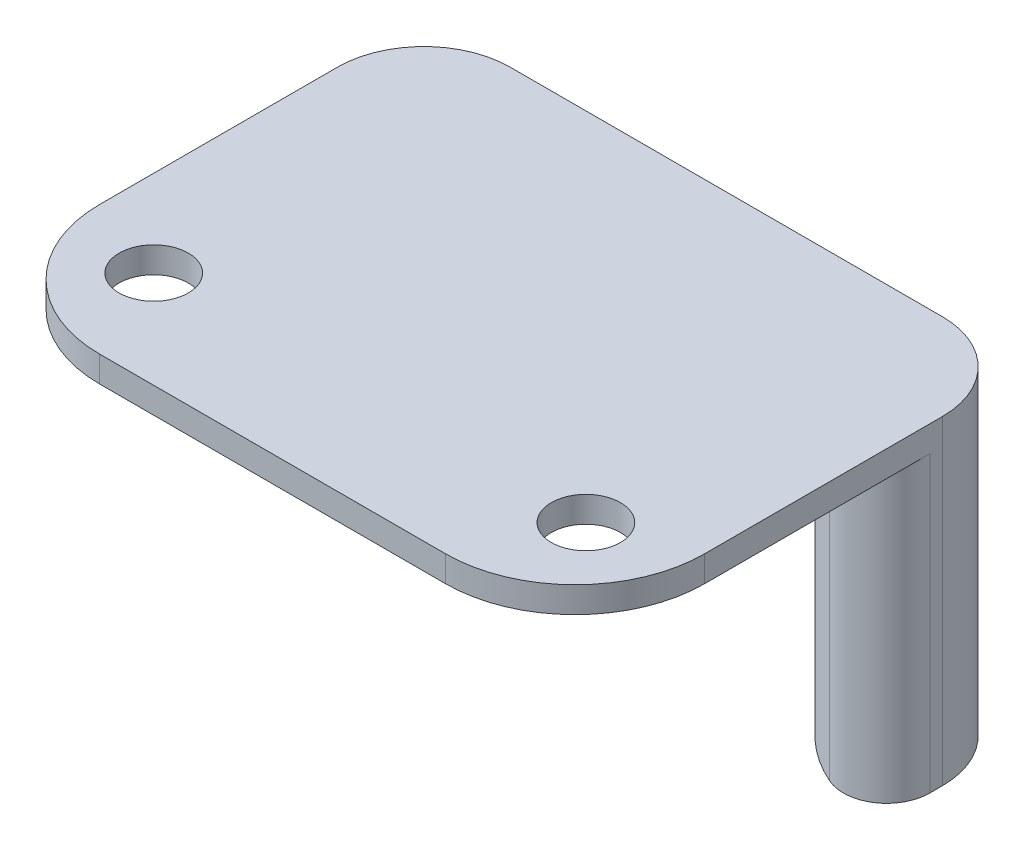
from build123d import *

# Parameters (mm, degrees)
SZKIC1_W                    = 28
SZKIC1_H                    = 21
SZKIC1_R                    = 1.6
DODANIE_WYCI_GNI_CIE1_DEPTH = 1.2
DODANIE_WYCI_GNI_CIE2_DEPTH = 13.6
ZAOKR_GLENIE3_R             = 6
ZAOKR_GLENIE1_R             = 4
ZAOKR_GLENIE2_R             = 2


with BuildPart() as part:
    # Szkic1 → Dodanie-wyciągnięcie1 (new body)
    with BuildSketch(Plane(origin=(0, 0, 0), x_dir=(1, 0, 0), z_dir=(0, 1, 0))):
        with Locations((0, 6)):
            Rectangle(SZKIC1_W, SZKIC1_H)
        with Locations((10, 0)):
            Circle(SZKIC1_R, mode=Mode.SUBTRACT)
        with Locations((-10, 0)):
            Circle(SZKIC1_R, mode=Mode.SUBTRACT)
    extrude(amount=DODANIE_WYCI_GNI_CIE1_DEPTH)

    # Szkic2 → Dodanie-wyciągnięcie2 (add)
    with BuildSketch(Plane.XZ):
        with BuildLine():
            Line((-14, -16.5), (-14, -9.5))
            ThreePointArc((-14, -9.5), (-9.050252532, -11.550252532), (-7, -16.5))
            Line((-7, -16.5), (-14, -16.5))
        make_face()
        with BuildLine():
            Line((14, -16.5), (7, -16.5))
            ThreePointArc((7, -16.5), (9.050252532, -11.550252532), (14, -9.5))
            Line((14, -9.5), (14, -16.5))
        make_face()
    extrude(amount=DODANIE_WYCI_GNI_CIE2_DEPTH)

    # Zaokrąglenie3
    zaokr_glenie3_edges = [part.edges().sort_by_distance(p)[0] for p in [
        (14, 0.6, 4.5),
        (-14, 0.6, 4.5),
    ]]
    fillet(zaokr_glenie3_edges, radius=ZAOKR_GLENIE3_R)

    # Zaokrąglenie1
    zaokr_glenie1_edges = [part.edges().sort_by_distance(p)[0] for p in [
        (14, -6.2, -16.5),
        (-14, -6.2, -16.5),
    ]]
    fillet(zaokr_glenie1_edges, radius=ZAOKR_GLENIE1_R)

    # Zaokrąglenie2
    zaokr_glenie2_edges = [part.edges().sort_by_distance(p)[0] for p in [
        (-14, -6.8, -9.5),
        (-7, -6.8, -16.5),
        (14, -6.8, -9.5),
        (7, -6.8, -16.5),
    ]]
    fillet(zaokr_glenie2_edges, radius=ZAOKR_GLENIE2_R)


solid = part.part
